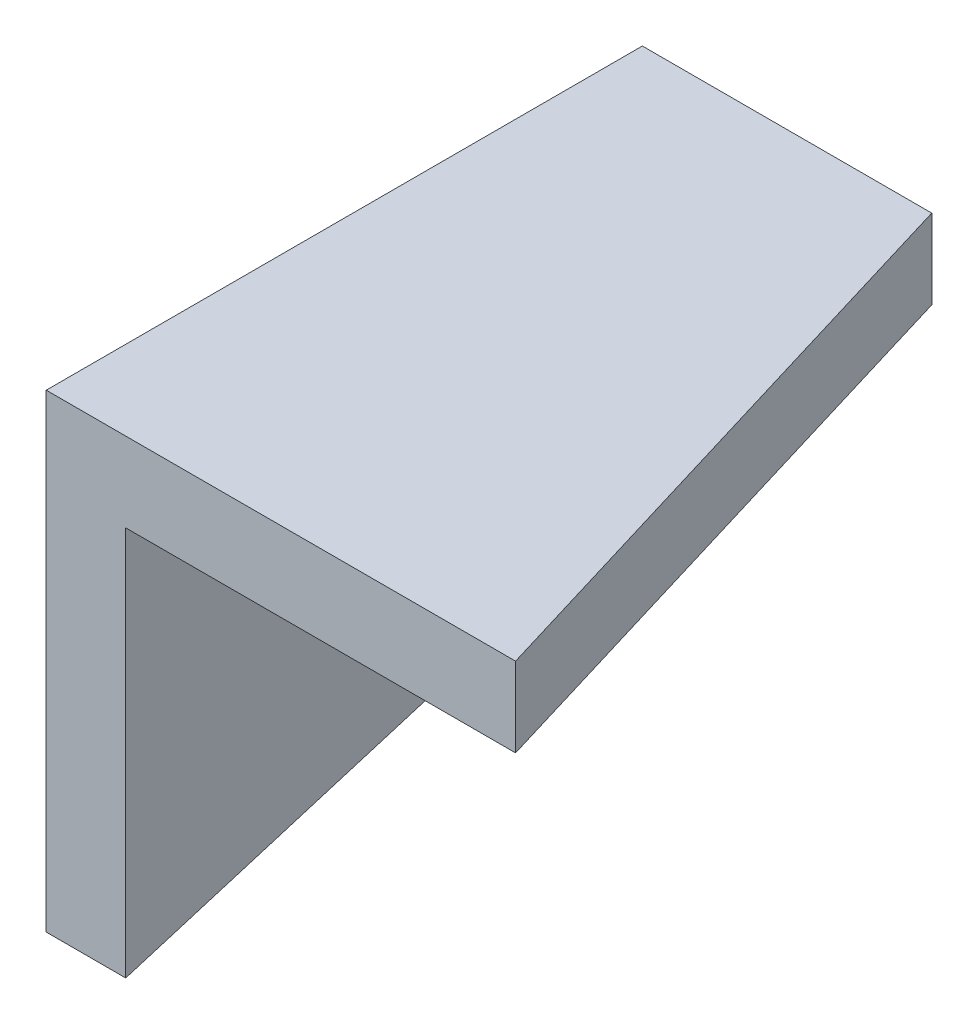
from build123d import *

# Parameters (mm, degrees)
BOSS_EXTRUDE1_DEPTH = 30
CUT_EXTRUDE1_DEPTH  = 10
CUT_EXTRUDE2_DEPTH  = 10


with BuildPart() as part:
    # Sketch1 → Boss-Extrude1 (new, symmetric)
    with BuildSketch(Plane.XY):
        Polygon((40, 0), (0, 0), (0, -40), (-8, -40), (-8, 8), (40, 8), align=None)
    extrude(amount=BOSS_EXTRUDE1_DEPTH, both=True)

    # Sketch2 → Cut-Extrude1 (cut)
    with BuildSketch(Plane.XZ):
        Polygon((39.240243059, 30), (21.129361647, -30), (40, -30), (40, 30), align=None)
    extrude(amount=-CUT_EXTRUDE1_DEPTH, mode=Mode.SUBTRACT)

    # Sketch3 → Cut-Extrude2 (cut)
    with BuildSketch(Plane(origin=(0, 0, 0), x_dir=(0, 0, -1), z_dir=(1, 0, 0))):
        Polygon((30, -21.13), (-30, -39.24), (-30, -40), (30, -40), align=None)
    extrude(amount=-CUT_EXTRUDE2_DEPTH, mode=Mode.SUBTRACT)


solid = part.part
